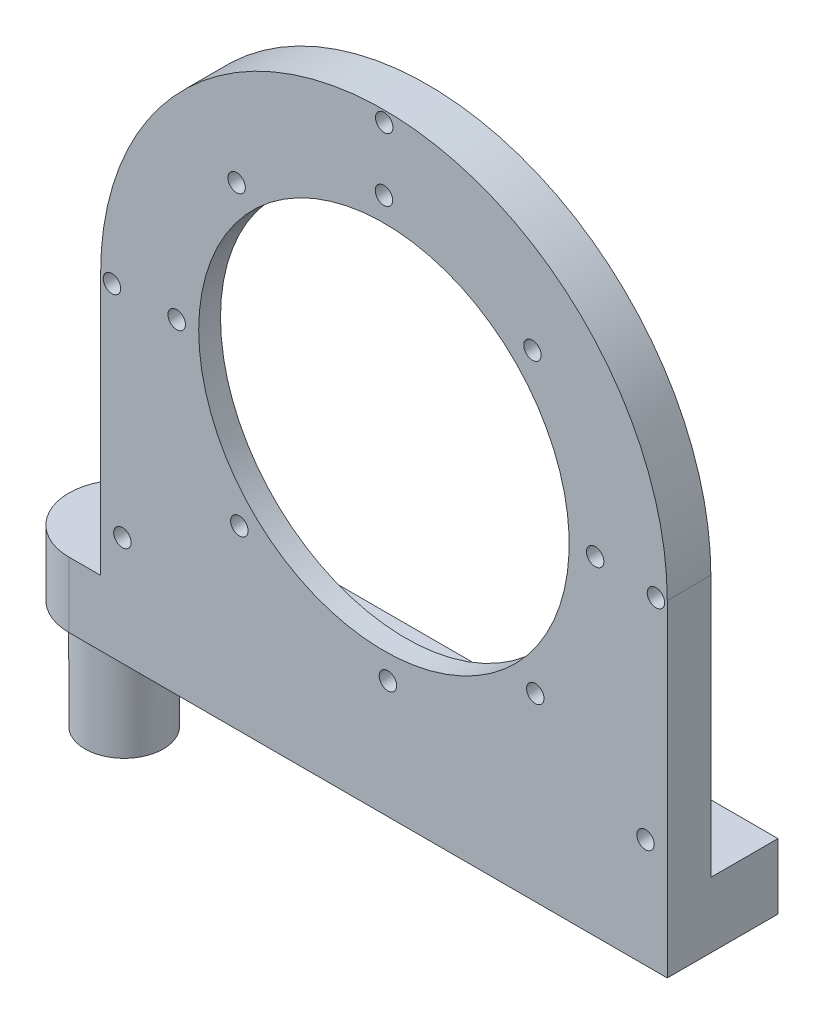
from build123d import *

# Parameters (mm, degrees)
BOSS_EXTRUDE1_DEPTH = 15
SKETCH2_R           = 9
BOSS_EXTRUDE2_DEPTH = 25
SKETCH3_W           = 130
SKETCH3_H           = 25.4
BOSS_EXTRUDE4_DEPTH = 125
CUT_EXTRUDE5_DEPTH  = 150
CUT_EXTRUDE6_DEPTH  = 15.4
SKETCH10_R          = 60
CUT_EXTRUDE9_DEPTH  = 5
SKETCH11_R          = 42.5
CUT_EXTRUDE10_DEPTH = 5
SKETCH12_R          = 2
CUT_EXTRUDE11_DEPTH = 10
SKETCH13_R          = 2
CUT_EXTRUDE12_DEPTH = 10
SKETCH14_R          = 2
CUT_EXTRUDE13_DEPTH = 10
SKETCH15_R          = 2
CUT_EXTRUDE14_DEPTH = 10


with BuildPart() as part:
    # Sketch1 → Boss-Extrude1 (new body)
    with BuildSketch(Plane(origin=(0, 0, 0), x_dir=(1, 0, 0), z_dir=(0, 1, 0))):
        with BuildLine():
            Line((-42.755305466, 17.232797428), (94.544694534, 17.232797428))
            Line((94.544694534, 17.232797428), (94.544694534, -8.167202572))
            Line((94.544694534, -8.167202572), (-42.755305466, -8.167202572))
            ThreePointArc((-42.755305466, -8.167202572), (-55.455305466, 4.532797428), (-42.755305466, 17.232797428))
        make_face()
    extrude(amount=BOSS_EXTRUDE1_DEPTH)

    # Sketch2 → Boss-Extrude2 (add)
    with BuildSketch(Plane.XZ):
        with Locations((-42.755305466, -4.532797428)):
            Circle(SKETCH2_R)
    extrude(amount=BOSS_EXTRUDE2_DEPTH)

    # Sketch3 → Boss-Extrude4 (add)
    with BuildSketch(Plane(origin=(0, 15, 0), x_dir=(1, 0, 0), z_dir=(0, 1, 0))):
        with Locations((29.544694534, 4.532797428)):
            Rectangle(SKETCH3_W, SKETCH3_H)
    extrude(amount=BOSS_EXTRUDE4_DEPTH)

    # Sketch6 → Cut-Extrude5 (cut)
    with BuildSketch(Plane(origin=(0, 0, -17.232797428), x_dir=(-1, 0, 0), z_dir=(0, 0, -1))):
        with BuildLine():
            Line((35.455305466, 140), (-29.544695, 140))
            ThreePointArc((-29.544695, 140), (16.417246079, 120.961940942), (35.455305466, 75))
            Line((35.455305466, 75), (35.455305466, 140))
        make_face()
        with BuildLine():
            Line((-29.544695, 140), (-94.544694534, 140))
            Line((-94.544694534, 140), (-94.544694534, 75))
            ThreePointArc((-94.544694534, 75), (-75.506635476, 120.961940612), (-29.544695, 140))
        make_face()
    extrude(amount=-CUT_EXTRUDE5_DEPTH, mode=Mode.SUBTRACT)

    # Sketch9 → Cut-Extrude6 (cut)
    with BuildSketch(Plane(origin=(0, 0, -17.232797428), x_dir=(-1, 0, 0), z_dir=(0, 0, -1))):
        with BuildLine():
            Line((35.455305466, 15), (-94.544694534, 15))
            Line((-94.544694534, 15), (-94.544694534, 75))
            ThreePointArc((-94.544694534, 75), (-29.544694534, 140), (35.455305466, 75))
            Line((35.455305466, 75), (35.455305466, 15))
        make_face()
    extrude(amount=-CUT_EXTRUDE6_DEPTH, mode=Mode.SUBTRACT)

    # Sketch10 → Cut-Extrude9 (cut)
    with BuildSketch(Plane(origin=(0, 0, -1.832797428), x_dir=(-1, 0, 0), z_dir=(0, 0, -1))):
        with Locations((-29.544694534, 75)):
            Circle(SKETCH10_R)
    extrude(amount=-CUT_EXTRUDE9_DEPTH, mode=Mode.SUBTRACT)

    # Sketch11 → Cut-Extrude10 (cut)
    with BuildSketch(Plane(origin=(0, 0, 3.167202572), x_dir=(-1, 0, 0), z_dir=(0, 0, -1))):
        with Locations((-29.544694534, 75)):
            Circle(SKETCH11_R)
    extrude(amount=-CUT_EXTRUDE10_DEPTH, mode=Mode.SUBTRACT)

    # Sketch12 → Cut-Extrude11 (cut)
    with BuildSketch(Plane(origin=(0, 0, 3.167202572), x_dir=(-1, 0, 0), z_dir=(0, 0, -1))):
        with Locations((-29.544694534, 123)):
            Circle(SKETCH12_R)
        with Locations((4.26307508, 108.619175914)):
            Circle(SKETCH12_R)
        with Locations((18, 74.544694534)):
            Circle(SKETCH12_R)
        with Locations((3.619175914, 40.73692492)):
            Circle(SKETCH12_R)
        with Locations((-30.455305466, 27)):
            Circle(SKETCH12_R)
        with Locations((-64.26307508, 41.380824086)):
            Circle(SKETCH12_R)
        with Locations((-78, 75.455305466)):
            Circle(SKETCH12_R)
        with Locations((-63.619175914, 109.26307508)):
            Circle(SKETCH12_R)
    extrude(amount=-CUT_EXTRUDE11_DEPTH, mode=Mode.SUBTRACT)

    # Sketch13 → Cut-Extrude12 (cut)
    with BuildSketch(Plane(origin=(0, 0, -1.832797428), x_dir=(-1, 0, 0), z_dir=(0, 0, -1))):
        with Locations((-89.544694534, 25)):
            Circle(SKETCH13_R)
        with Locations((30.455305466, 25)):
            Circle(SKETCH13_R)
    extrude(amount=-CUT_EXTRUDE12_DEPTH, mode=Mode.SUBTRACT)

    # Sketch14 → Cut-Extrude13 (cut)
    with BuildSketch(Plane(origin=(0, 0, -1.832797428), x_dir=(-1, 0, 0), z_dir=(0, 0, -1))):
        with Locations((-91.944694534, 74.269730636)):
            Circle(SKETCH14_R)
        with Locations((32.855305466, 74.269730636)):
            Circle(SKETCH14_R)
    extrude(amount=-CUT_EXTRUDE13_DEPTH, mode=Mode.SUBTRACT)

    # Sketch15 → Cut-Extrude14 (cut)
    with BuildSketch(Plane(origin=(0, 0, -1.832797428), x_dir=(-1, 0, 0), z_dir=(0, 0, -1))):
        with Locations((-29.607268832, 137.499968676)):
            Circle(SKETCH15_R)
    extrude(amount=-CUT_EXTRUDE14_DEPTH, mode=Mode.SUBTRACT)


solid = part.part
